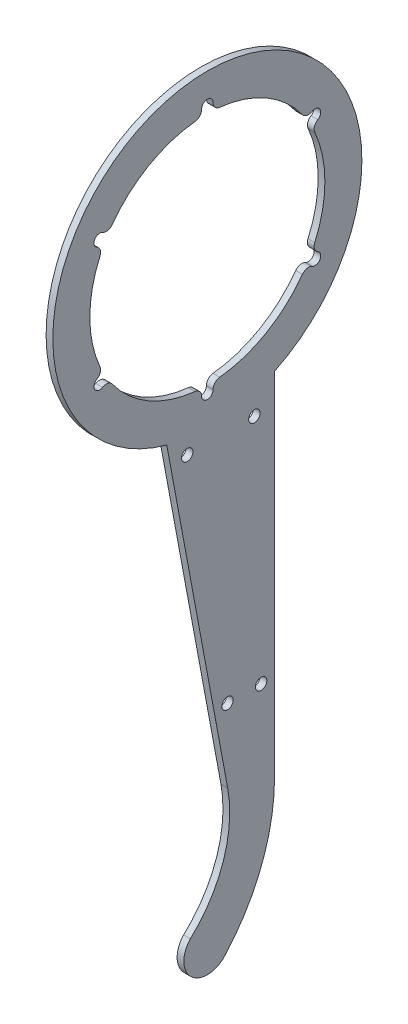
from build123d import *

# Parameters (mm, degrees)
SKETCH_1_R      = 1.7
EXTRUDE_3_DEPTH = 2


with BuildPart() as part:
    # 草图1 → 凸台-拉伸3 (new body)
    with BuildSketch(Plane(origin=(0, 0, 0), x_dir=(0, 0, -1), z_dir=(1, 0, 0))):
        with BuildLine():
            Line((-12.086651446, -44.383700351), (6.041480072, -141.833924558))
            ThreePointArc((6.041480072, -141.833924558), (4.790925001, -159.943403755), (-5.076247296, -175.180071226))
            ThreePointArc((-5.076247296, -175.180071226), (-4.750224064, -185.141533949), (5.205863532, -184.679635124))
            ThreePointArc((5.205863532, -184.679635124), (16.174710493, -166.755300274), (20, -146.092179898))
            Line((20, -146.092179898), (20, -41.424630354))
            ThreePointArc((20, -41.424630354), (-4.224250838, 45.80562962), (-12.086651446, -44.383700351))
        make_face()
        with Locations((-6, -50)):
            Circle(SKETCH_1_R, mode=Mode.SUBTRACT)
        with Locations((14, -50)):
            Circle(SKETCH_1_R, mode=Mode.SUBTRACT)
        with Locations((6, -120)):
            Circle(SKETCH_1_R, mode=Mode.SUBTRACT)
        with Locations((16, -120)):
            Circle(SKETCH_1_R, mode=Mode.SUBTRACT)
        with BuildLine():
            ThreePointArc((1.7, -37), (2.270210089, -35.513550931), (3.688261329, -34.789809912))
            ThreePointArc((3.688261329, -34.789809912), (17.492385095, -30.297699731), (28.284728512, -20.589032962))
            ThreePointArc((28.284728512, -20.589032962), (29.62053224, -19.722835075), (31.19293994, -19.972243186))
            ThreePointArc((31.19293994, -19.972243186), (33.515183126, -19.35), (32.89293994, -17.027756814))
            ThreePointArc((32.89293994, -17.027756814), (31.89074233, -15.790715856), (31.972989841, -14.200776949))
            ThreePointArc((31.972989841, -14.200776949), (34.984770191, 0), (31.972989841, 14.200776949))
            ThreePointArc((31.972989841, 14.200776949), (31.89074233, 15.790715856), (32.89293994, 17.027756814))
            ThreePointArc((32.89293994, 17.027756814), (33.515183126, 19.35), (31.19293994, 19.972243186))
            ThreePointArc((31.19293994, 19.972243186), (29.62053224, 19.722835075), (28.284728512, 20.589032962))
            ThreePointArc((28.284728512, 20.589032962), (17.492385095, 30.297699731), (3.688261329, 34.789809912))
            ThreePointArc((3.688261329, 34.789809912), (2.270210089, 35.513550931), (1.7, 37))
            ThreePointArc((1.7, 37), (0, 38.7), (-1.7, 37))
            ThreePointArc((-1.7, 37), (-2.270210089, 35.513550931), (-3.688261329, 34.789809912))
            ThreePointArc((-3.688261329, 34.789809912), (-17.492385095, 30.297699731), (-28.284728512, 20.589032962))
            ThreePointArc((-28.284728512, 20.589032962), (-29.62053224, 19.722835075), (-31.19293994, 19.972243186))
            ThreePointArc((-31.19293994, 19.972243186), (-33.515183126, 19.35), (-32.89293994, 17.027756814))
            ThreePointArc((-32.89293994, 17.027756814), (-31.89074233, 15.790715856), (-31.972989841, 14.200776949))
            ThreePointArc((-31.972989841, 14.200776949), (-34.984770191, 0), (-31.972989841, -14.200776949))
            ThreePointArc((-31.972989841, -14.200776949), (-31.89074233, -15.790715856), (-32.89293994, -17.027756814))
            ThreePointArc((-32.89293994, -17.027756814), (-33.515183126, -19.35), (-31.19293994, -19.972243186))
            ThreePointArc((-31.19293994, -19.972243186), (-29.62053224, -19.722835075), (-28.284728512, -20.589032962))
            ThreePointArc((-28.284728512, -20.589032962), (-17.492385095, -30.297699731), (-3.688261329, -34.789809912))
            ThreePointArc((-3.688261329, -34.789809912), (-2.270210089, -35.513550931), (-1.7, -37))
            ThreePointArc((-1.7, -37), (0, -38.7), (1.7, -37))
        make_face(mode=Mode.SUBTRACT)
    extrude(amount=EXTRUDE_3_DEPTH)


solid = part.part
